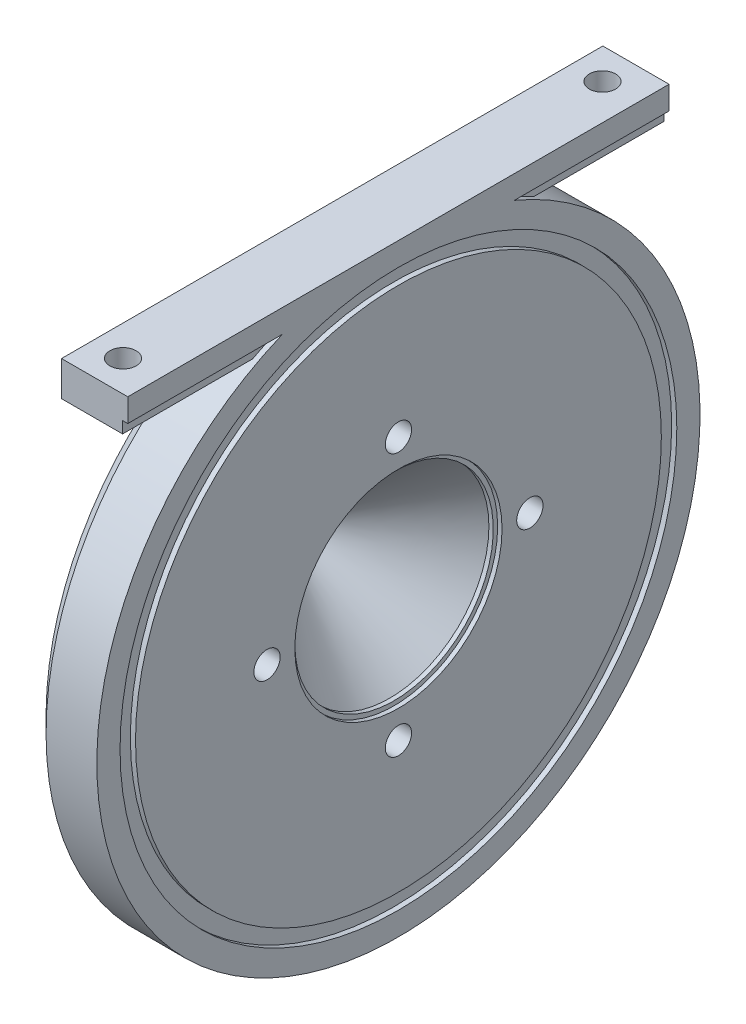
from build123d import *

# Parameters (mm, degrees)
M3_CLEARANCE_HOLE1_D     = 3.4
M3_CLEARANCE_HOLE1_DEPTH = 8.566
M3_CLEARANCE_HOLE1_TIP   = 1.021463052
CHAMFER1_SIZE            = 2
BOSS_EXTRUDE1_DEPTH      = 35
SKETCH9_R                = 1.7
CUT_EXTRUDE1_DEPTH       = 10


with BuildPart() as part:
    # Sketch1 → Revolve17 (revolve)
    with BuildSketch(Plane.XY):
        Polygon((-14.010170791, 3.15), (-14.010170791, 3.8), (-18.343504124, 3.15), (-18.343504124, 1.9), (0, 1.9), (12.030253634, 12.834), (12.596253634, 12.834), (12.596253634, 13.4), (13.162253634, 13.4), (13.162253634, 34), (12.495253634, 34), (12.495253634, 36), (13.162253634, 36), (13.162253634, 39), (4.596253634, 39), (4.596253634, 12.834), (-5.343504124, 3.8), (-9.676837458, 3.15), (-9.676837458, 3.8), align=None)
    revolve(axis=Axis((-801.927103621, 0, 0), (1, 0, 0)))

    # M3 Clearance Hole1
    with Locations(Plane.ZY.offset(-4.596253634)):
        with Locations((0, -16.994664238), (0, 16.994664238), (16.994664238, 0), (-16.994664238, 0)):
            Hole(M3_CLEARANCE_HOLE1_D / 2, depth=M3_CLEARANCE_HOLE1_DEPTH)
            with Locations((0, 0, -(M3_CLEARANCE_HOLE1_DEPTH + M3_CLEARANCE_HOLE1_TIP / 2))):  # 118° drill point
                Cone(0, M3_CLEARANCE_HOLE1_D / 2, M3_CLEARANCE_HOLE1_TIP, mode=Mode.SUBTRACT)

    # Chamfer1
    chamfer1_edges = [part.edges().sort_by_distance(p)[0] for p in [
        (4.596253634, -39, 0),
    ]]
    chamfer(chamfer1_edges, length=CHAMFER1_SIZE)

    # Sketch1<11> → Boss-Extrude1 (add, symmetric)
    with BuildSketch(Plane.XY):
        Polygon((4.596253634, 39), (4.596253634, 34.5), (12.495253634, 34.5), (12.495253634, 36), (13.162253634, 36), (13.162253634, 39), align=None)
    extrude(amount=BOSS_EXTRUDE1_DEPTH, both=True)

    # Sketch9 → Cut-Extrude1 (cut)
    with BuildSketch(Plane(origin=(0, 34.5, 0), x_dir=(-1, 0, 0), z_dir=(0, -1, 0))):
        with Locations((-8.545753634, -31)):
            Circle(SKETCH9_R)
        with Locations((-8.545753634, 31)):
            Circle(SKETCH9_R)
    extrude(amount=-CUT_EXTRUDE1_DEPTH, mode=Mode.SUBTRACT)


solid = part.part
